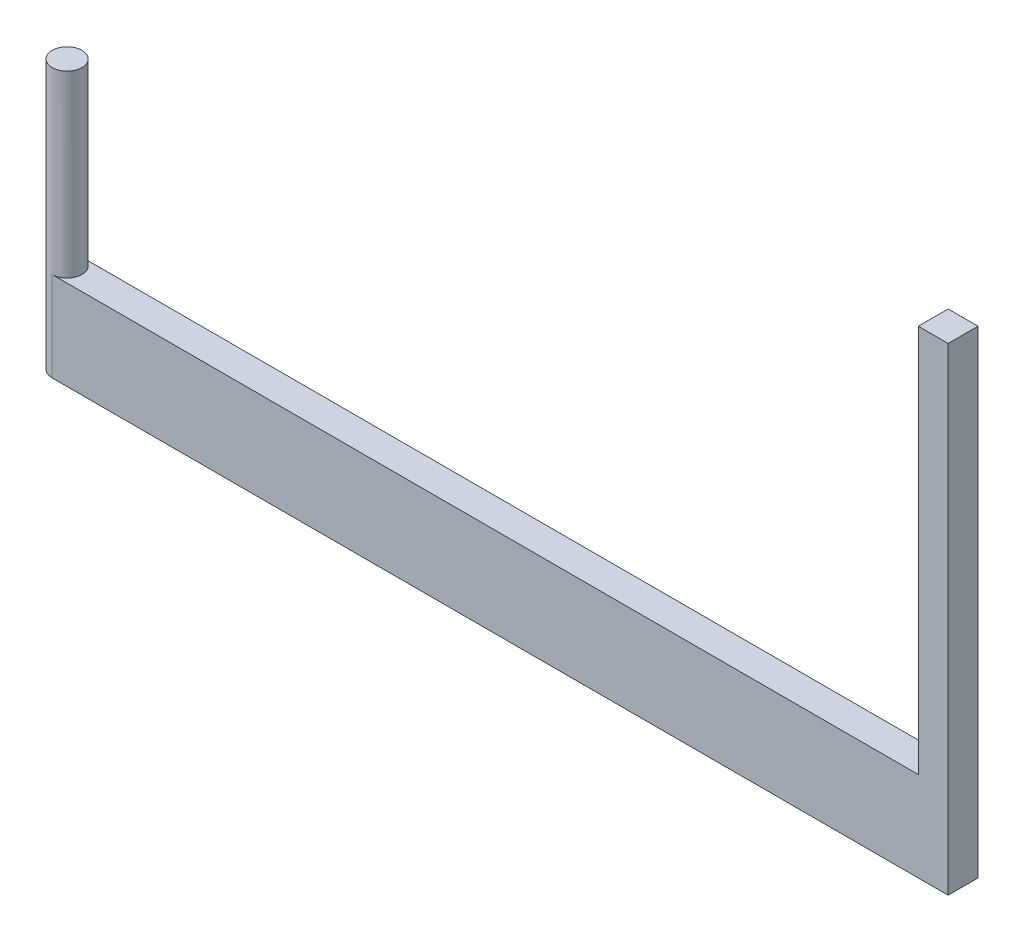
from build123d import *

# Parameters (mm, degrees)
SKETCH1_R           = 2.5
BOSS_EXTRUDE1_DEPTH = 45
BOSS_EXTRUDE2_DEPTH = 15
SKETCH3_W           = 5
SKETCH3_H           = 65
BOSS_EXTRUDE5_DEPTH = 5


with BuildPart() as part:
    # Sketch1 → Boss-Extrude1 (new body)
    with BuildSketch(Plane(origin=(0, 0, 0), x_dir=(1, 0, 0), z_dir=(0, 1, 0))):
        Circle(SKETCH1_R)
    extrude(amount=BOSS_EXTRUDE1_DEPTH)

    # Sketch1<3> → Boss-Extrude2 (add)
    with BuildSketch(Plane(origin=(0, 0, 0), x_dir=(1, 0, 0), z_dir=(0, 1, 0))):
        with BuildLine():
            Line((150, 2.5), (0, 2.5))
            ThreePointArc((0, 2.5), (1.767766953, 1.767766953), (2.5, 0))
            ThreePointArc((2.5, 0), (1.767766953, -1.767766953), (0, -2.5))
            Line((0, -2.5), (150, -2.5))
            Line((150, -2.5), (150, 2.5))
        make_face()
    extrude(amount=BOSS_EXTRUDE2_DEPTH)

    # Sketch3 → Boss-Extrude5 (add)
    with BuildSketch(Plane.XY.offset(2.5)):
        with Locations((147.5, 47.5)):
            Rectangle(SKETCH3_W, SKETCH3_H)
    extrude(amount=-BOSS_EXTRUDE5_DEPTH)


solid = part.part
